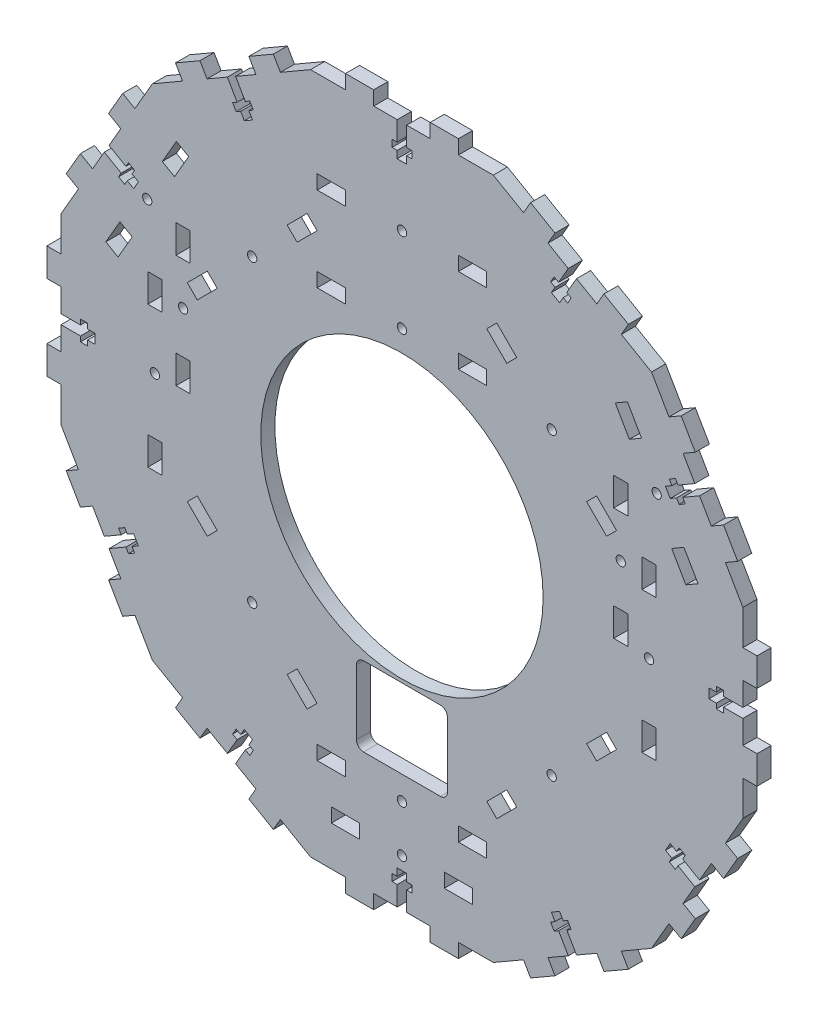
from build123d import *

# Parameters (mm, degrees)
BOSS_EXTRUDE1_DEPTH = 6.35
SKETCH2_W           = 12.7
SKETCH2_H           = 6.35
BOSS_EXTRUDE2_DEPTH = 6.35
CUT_EXTRUDE1_DEPTH  = 6.35
CIRPATTERN1_COUNT   = 12
SKETCH5_R           = 63.5
CUT_EXTRUDE2_DEPTH  = 6.35
SKETCH7_R           = 2.0955
SKETCH7_W           = 12.7
SKETCH7_H           = 6.35
CUT_EXTRUDE3_DEPTH  = 6.35
SKETCH8_R           = 2.0955
SKETCH8_W           = 6.35
SKETCH8_H           = 12.7
CUT_EXTRUDE4_DEPTH  = 6.35
CIRPATTERN2_COUNT   = 3
SKETCH9_R           = 2.0955
SKETCH9_W           = 12.7
SKETCH9_H           = 6.35
CUT_EXTRUDE5_DEPTH  = 6.35
CUT_EXTRUDE6_REACH  = 227.926
SKETCH10_R          = 2.0955
CIRPATTERN3_COUNT   = 4
CUT_EXTRUDE7_REACH  = 227.926
SKETCH11_W          = 40.894
SKETCH11_H          = 35.56
FILLET1_R           = 3.175
CUT_EXTRUDE8_REACH  = 227.926
SKETCH12_R          = 2.0955
SKETCH12_W          = 12.7
SKETCH12_H          = 6.35


with BuildPart() as part:
    # Sketch1 → Boss-Extrude1 (new body)
    with BuildSketch(Plane.XY):
        Polygon((41.08752341, 153.340724923), (-41.08752341, 153.340724923), (-112.253201513, 112.253201513), (-153.340724923, 41.08752341), (-153.340724923, -41.08752341), (-112.253201513, -112.253201513), (-41.08752341, -153.340724923), (41.08752341, -153.340724923), (112.253201513, -112.253201513), (153.340724923, -41.08752341), (153.340724923, 41.08752341), (112.253201513, 112.253201513), align=None)
    extrude(amount=BOSS_EXTRUDE1_DEPTH)

    # Sketch2 → Boss-Extrude2 (add)
    with BuildSketch(Plane.XY.offset(6.35)):
        with Locations((-19.05, 156.515724923)):
            Rectangle(SKETCH2_W, SKETCH2_H)
        with Locations((19.05, 156.515724923)):
            Rectangle(SKETCH2_W, SKETCH2_H)
    boss_extrude2 = extrude(amount=-BOSS_EXTRUDE2_DEPTH)

    # Sketch2<3> → Cut-Extrude1 (cut)
    with BuildSketch(Plane.XY.offset(6.35)):
        Polygon((-2.1336, 153.340724923), (-2.1336, 144.577724923), (-4.445, 144.577724923), (-4.445, 141.402724923), (-2.1336, 141.402724923), (-2.1336, 138.100724923), (2.1336, 138.100724923), (2.1336, 141.402724923), (4.445, 141.402724923), (4.445, 144.577724923), (2.1336, 144.577724923), (2.1336, 153.340724923), align=None)
    cut_extrude1 = extrude(amount=-CUT_EXTRUDE1_DEPTH, mode=Mode.SUBTRACT)

    # CirPattern1: Boss-Extrude2, Cut-Extrude1 ×12 about axis
    cirpattern1_axis = Axis((0, 0, 0), (0, 0, 1))
    add([boss_extrude2.rotate(cirpattern1_axis, i * 360 / CIRPATTERN1_COUNT) for i in range(1, CIRPATTERN1_COUNT)])
    add([cut_extrude1.rotate(cirpattern1_axis, i * 360 / CIRPATTERN1_COUNT) for i in range(1, CIRPATTERN1_COUNT)], mode=Mode.SUBTRACT)

    # Sketch5 → Cut-Extrude2 (cut)
    with BuildSketch(Plane.XY.offset(6.35)):
        Circle(SKETCH5_R)
    extrude(amount=-CUT_EXTRUDE2_DEPTH, mode=Mode.SUBTRACT)

    # Sketch7 → Cut-Extrude3 (cut)
    with BuildSketch(Plane.XY.offset(6.35)):
        with Locations((0, -132.275129199)):
            Circle(SKETCH7_R)
        with Locations((-25.4, -132.275129199)):
            Rectangle(SKETCH7_W, SKETCH7_H)
        with Locations((25.4, -132.275129199)):
            Rectangle(SKETCH7_W, SKETCH7_H)
    cut_extrude3 = extrude(amount=-CUT_EXTRUDE3_DEPTH, mode=Mode.SUBTRACT)

    # Sketch8 → Cut-Extrude4 (cut)
    with BuildSketch(Plane.XY.offset(6.35)):
        with Locations((98.425, 31.75)):
            Circle(SKETCH8_R)
        with Locations((98.425, 57.15)):
            Rectangle(SKETCH8_W, SKETCH8_H)
        with Locations((98.425, 6.35)):
            Rectangle(SKETCH8_W, SKETCH8_H)
    cut_extrude4 = extrude(amount=-CUT_EXTRUDE4_DEPTH, mode=Mode.SUBTRACT)

    # CirPattern2: Cut-Extrude3 ×3 about axis
    cirpattern2_axis = Axis((0, 0, 0), (0, 0, 1))
    for i in range(1, CIRPATTERN2_COUNT):
        add(cut_extrude3.rotate(cirpattern2_axis, i * 360 / CIRPATTERN2_COUNT), mode=Mode.SUBTRACT)

    # Mirror1: Cut-Extrude4 across plane
    add(cut_extrude4.mirror(Plane(origin=(0, 0, 0), x_dir=(0, 0, 1), z_dir=(1, 0, 0))), mode=Mode.SUBTRACT)

    # Sketch9 → Cut-Extrude5 (cut)
    with BuildSketch(Plane.XY.offset(6.35)):
        with Locations((0, -111.125)):
            Circle(SKETCH9_R)
        with Locations((-31.75, -111.125)):
            Rectangle(SKETCH9_W, SKETCH9_H)
        with Locations((31.75, -111.125)):
            Rectangle(SKETCH9_W, SKETCH9_H)
    cut_extrude5 = extrude(amount=-CUT_EXTRUDE5_DEPTH, mode=Mode.SUBTRACT)

    # Sketch10 → Cut-Extrude6 (cut, up to next)
    with BuildSketch(Plane.XY.offset(6.35), mode=Mode.PRIVATE) as cut_extrude6_sk1:
        with Locations((67.351920908, 67.351920908)):
            Circle(SKETCH10_R)
    cut_extrude6_tool1 = extrude(cut_extrude6_sk1.sketch, amount=-CUT_EXTRUDE6_REACH, mode=Mode.PRIVATE) & part.part
    # Sketch10 → Cut-Extrude6 (cut, up to next)
    with BuildSketch(Plane.XY.offset(6.35), mode=Mode.PRIVATE) as cut_extrude6_sk2:
        Polygon((47.146344636, 83.06736912), (38.166088515, 92.047625241), (42.656216575, 96.537753301), (51.636472696, 87.55749718), align=None)
    cut_extrude6_tool2 = extrude(cut_extrude6_sk2.sketch, amount=-CUT_EXTRUDE6_REACH, mode=Mode.PRIVATE) & part.part
    # Sketch10 → Cut-Extrude6 (cut, up to next)
    with BuildSketch(Plane.XY.offset(6.35), mode=Mode.PRIVATE) as cut_extrude6_sk3:
        Polygon((92.047625241, 38.166088515), (96.537753301, 42.656216575), (87.55749718, 51.636472696), (83.06736912, 47.146344636), align=None)
    cut_extrude6_tool3 = extrude(cut_extrude6_sk3.sketch, amount=-CUT_EXTRUDE6_REACH, mode=Mode.PRIVATE) & part.part
    cut_extrude6_1 = cut_extrude6_tool1.solids().sort_by_distance((67.351921, 67.351921, 6.35))[0]
    add(cut_extrude6_1, mode=Mode.SUBTRACT)
    cut_extrude6_2 = cut_extrude6_tool2.solids().sort_by_distance((44.901281, 89.802561, 6.35))[0]
    add(cut_extrude6_2, mode=Mode.SUBTRACT)
    cut_extrude6_3 = cut_extrude6_tool3.solids().sort_by_distance((89.802561, 44.901281, 6.35))[0]
    add(cut_extrude6_3, mode=Mode.SUBTRACT)
    cut_extrude6 = cut_extrude6_1 + cut_extrude6_2 + cut_extrude6_3  # Cut-Extrude6 as one shape, for the pattern or mirror that repeats it

    # CirPattern3: Cut-Extrude5, Cut-Extrude6 ×4 about axis
    cirpattern3_axis = Axis((0, 0, 0), (0, 0, 1))
    add([cut_extrude5.rotate(cirpattern3_axis, i * 360 / CIRPATTERN3_COUNT) for i in range(1, CIRPATTERN3_COUNT)], mode=Mode.SUBTRACT)
    add([cut_extrude6.rotate(cirpattern3_axis, i * 360 / CIRPATTERN3_COUNT) for i in range(1, CIRPATTERN3_COUNT)], mode=Mode.SUBTRACT)

    # Sketch11 → Cut-Extrude7 (cut, up to next)
    with BuildSketch(Plane.XY.offset(6.35), mode=Mode.PRIVATE) as cut_extrude7_sk1:
        with Locations((0, -82.745129199)):
            Rectangle(SKETCH11_W, SKETCH11_H)
    cut_extrude7_tool1 = extrude(cut_extrude7_sk1.sketch, amount=-CUT_EXTRUDE7_REACH, mode=Mode.PRIVATE) & part.part
    add(cut_extrude7_tool1.solids().sort_by_distance((0, -82.745129, 6.35))[0], mode=Mode.SUBTRACT)

    # Fillet1
    fillet1_edges = [part.edges().sort_by_distance(p)[0] for p in [
        (-20.447, -64.965129199, 3.175),
        (-20.447, -100.525129199, 3.175),
        (20.447, -100.525129199, 3.175),
        (20.447, -64.965129199, 3.175),
    ]]
    fillet(fillet1_edges, radius=FILLET1_R)

    # Sketch12 → Cut-Extrude8 (cut, up to next)
    with BuildSketch(Plane.XY.offset(6.35), mode=Mode.PRIVATE) as cut_extrude8_sk1:
        with Locations((0, 73.025)):
            Circle(SKETCH12_R)
    cut_extrude8_tool1 = extrude(cut_extrude8_sk1.sketch, amount=-CUT_EXTRUDE8_REACH, mode=Mode.PRIVATE) & part.part
    # Sketch12 → Cut-Extrude8 (cut, up to next)
    with BuildSketch(Plane.XY.offset(6.35), mode=Mode.PRIVATE) as cut_extrude8_sk2:
        with Locations((-31.75, 73.025)):
            Rectangle(SKETCH12_W, SKETCH12_H)
    cut_extrude8_tool2 = extrude(cut_extrude8_sk2.sketch, amount=-CUT_EXTRUDE8_REACH, mode=Mode.PRIVATE) & part.part
    # Sketch12 → Cut-Extrude8 (cut, up to next)
    with BuildSketch(Plane.XY.offset(6.35), mode=Mode.PRIVATE) as cut_extrude8_sk3:
        with Locations((31.75, 73.025)):
            Rectangle(SKETCH12_W, SKETCH12_H)
    cut_extrude8_tool3 = extrude(cut_extrude8_sk3.sketch, amount=-CUT_EXTRUDE8_REACH, mode=Mode.PRIVATE) & part.part
    add(cut_extrude8_tool1.solids().sort_by_distance((0, 73.025, 6.35))[0], mode=Mode.SUBTRACT)
    add(cut_extrude8_tool2.solids().sort_by_distance((-31.75, 73.025, 6.35))[0], mode=Mode.SUBTRACT)
    add(cut_extrude8_tool3.solids().sort_by_distance((31.75, 73.025, 6.35))[0], mode=Mode.SUBTRACT)


solid = part.part
